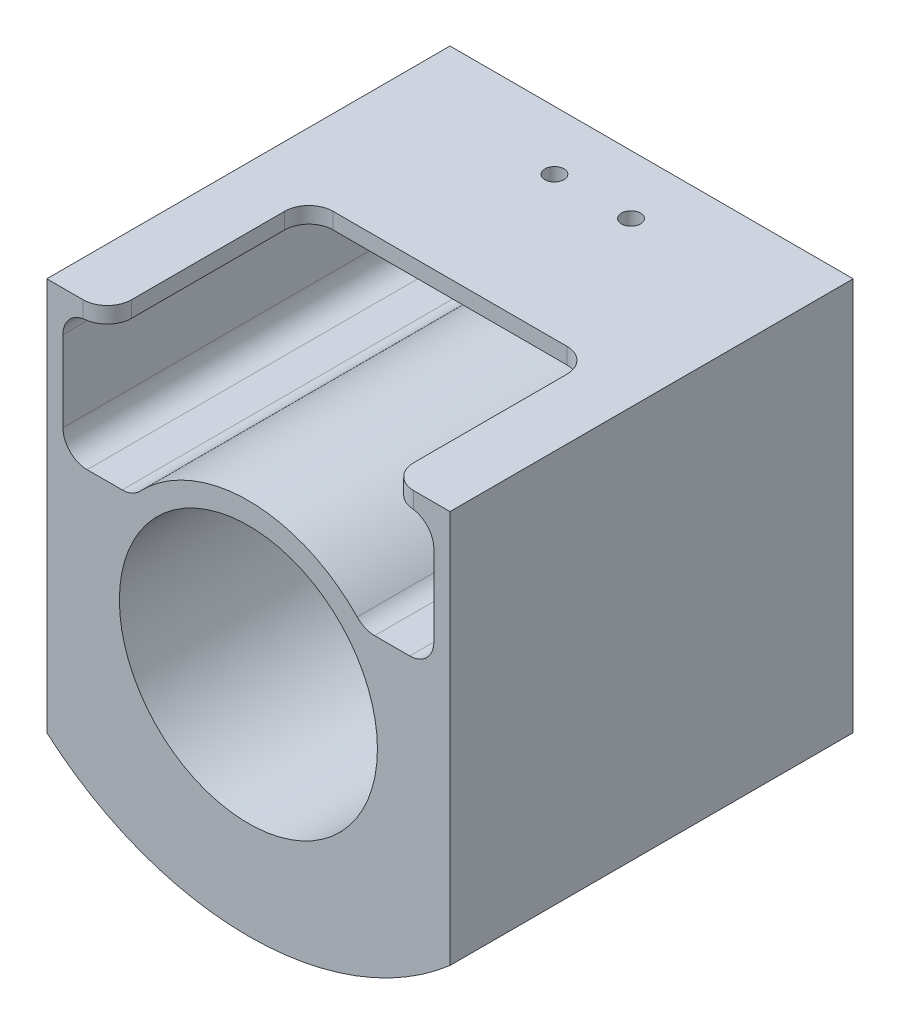
from build123d import *

# Parameters (mm, degrees)
BOSS_EXTRUDE2_DEPTH     = 50
CUT_EXTRUDE1_DEPTH      = 68.650646708
CUT_EXTRUDE1_DEPTH_BACK = 68.650646708
SKETCH2_R               = 16
CUT_EXTRUDE3_DEPTH      = 68.650646708
FILLET1_R               = 3
SKETCH5_W               = 35
SKETCH5_H               = 25
CUT_EXTRUDE4_DEPTH      = 10
FILLET2_R               = 3
SKETCH6_R               = 9.5
SKETCH6_R_2             = 1.25
BOSS_EXTRUDE3_DEPTH     = 5
CUT_EXTRUDE5_DEPTH      = 68.650646782
CUT_EXTRUDE5_DEPTH_BACK = 68.650646782
SKETCH7_R               = 2.5
CUT_EXTRUDE6_REACH      = 82.626
SKETCH8_R               = 1.175


with BuildPart() as part:
    # Sketch1 → Boss-Extrude2 (new body)
    with BuildSketch(Plane.XY):
        with BuildLine():
            Line((-25, 0), (-25, -28.750826075))
            ThreePointArc((-25, -28.750826075), (0, -38.1), (25, -28.750826075))
            Line((25, -28.750826075), (25, 0))
            Line((25, 0), (25, 20))
            Line((25, 20), (-25, 20))
            Line((-25, 20), (-25, 0))
        make_face()
    extrude(amount=BOSS_EXTRUDE2_DEPTH)

    # Sketch2 → Cut-Extrude1 (cut, two sides: drawn at the far end of the back side and taken through both)
    with BuildSketch(Plane.XY.offset(50).offset(-CUT_EXTRUDE1_DEPTH_BACK)):
        with Locations((0, -10)):
            Circle(SKETCH2_R)
    extrude(amount=CUT_EXTRUDE1_DEPTH + CUT_EXTRUDE1_DEPTH_BACK, mode=Mode.SUBTRACT)

    # Sketch4 → Cut-Extrude3 (cut, through all)
    with BuildSketch(Plane.XY.offset(50)):
        with BuildLine():
            Line((-23, 18), (23, 18))
            Line((23, 18), (23, 2))
            Line((23, 2), (14.317821063, 2))
            ThreePointArc((14.317821063, 2), (0, 8.681541692), (-14.317821063, 2))
            Line((-14.317821063, 2), (-23, 2))
            Line((-23, 2), (-23, 18))
        make_face()
    extrude(amount=-CUT_EXTRUDE3_DEPTH, mode=Mode.SUBTRACT)

    # Fillet1
    fillet1_edges = [part.edges().sort_by_distance(p)[0] for p in [
        (23, 18, 25),
        (23, 2, 25),
        (14.317821063, 2, 25),
        (-14.317821063, 2, 25),
        (-23, 2, 25),
        (-23, 18, 25),
    ]]
    fillet(fillet1_edges, radius=FILLET1_R)

    # Sketch5 → Cut-Extrude4 (cut)
    with BuildSketch(Plane(origin=(0, 20, 0), x_dir=(1, 0, 0), z_dir=(0, 1, 0))):
        with Locations((0, -37.5)):
            Rectangle(SKETCH5_W, SKETCH5_H)
    extrude(amount=-CUT_EXTRUDE4_DEPTH, mode=Mode.SUBTRACT)

    # Fillet2
    fillet2_edges = [part.edges().sort_by_distance(p)[0] for p in [
        (17.5, 19, 50),
        (17.5, 19, 25),
        (-17.5, 19, 25),
        (-17.5, 19, 50),
    ]]
    fillet(fillet2_edges, radius=FILLET2_R)

    # Sketch6 → Boss-Extrude3 (add)
    with BuildSketch(Plane.XY.offset(14)):
        with BuildLine():
            ThreePointArc((16, -10), (0, 6), (-16, -10))
            ThreePointArc((-16, -10), (0, -26), (16, -10))
        make_face()
        with Locations((0, -10)):
            Circle(SKETCH6_R, mode=Mode.SUBTRACT)
        with Locations((0, 3)):
            Circle(SKETCH6_R_2, mode=Mode.SUBTRACT)
        with Locations((13, -10)):
            Circle(SKETCH6_R_2, mode=Mode.SUBTRACT)
        with Locations((-13, -10)):
            Circle(SKETCH6_R_2, mode=Mode.SUBTRACT)
        with Locations((0, -23)):
            Circle(SKETCH6_R_2, mode=Mode.SUBTRACT)
    extrude(amount=-BOSS_EXTRUDE3_DEPTH)

    # Sketch7 → Cut-Extrude5 (cut, two sides: drawn at the far end of the back side and taken through both)
    with BuildSketch(Plane(origin=(0, 0, 0), x_dir=(0, 0, -1), z_dir=(1, 0, 0)).offset(-CUT_EXTRUDE5_DEPTH_BACK)):
        with Locations((-40, -32)):
            Circle(SKETCH7_R)
        with Locations((-10, -32)):
            Circle(SKETCH7_R)
    extrude(amount=CUT_EXTRUDE5_DEPTH + CUT_EXTRUDE5_DEPTH_BACK, mode=Mode.SUBTRACT)

    # Sketch8 → Cut-Extrude6 (cut, up to next)
    with BuildSketch(Plane(origin=(0, 20, 0), x_dir=(1, 0, 0), z_dir=(0, 1, 0)), mode=Mode.PRIVATE) as cut_extrude6_sk1:
        with Locations((-4.75, -7.3)):
            Circle(SKETCH8_R)
    cut_extrude6_tool1 = extrude(cut_extrude6_sk1.sketch, amount=-CUT_EXTRUDE6_REACH, mode=Mode.PRIVATE) & part.part
    # Sketch8 → Cut-Extrude6 (cut, up to next)
    with BuildSketch(Plane(origin=(0, 20, 0), x_dir=(1, 0, 0), z_dir=(0, 1, 0)), mode=Mode.PRIVATE) as cut_extrude6_sk2:
        with Locations((4.75, -7.3)):
            Circle(SKETCH8_R)
    cut_extrude6_tool2 = extrude(cut_extrude6_sk2.sketch, amount=-CUT_EXTRUDE6_REACH, mode=Mode.PRIVATE) & part.part
    add(cut_extrude6_tool1.solids().sort_by_distance((-4.75, 20, 7.3))[0], mode=Mode.SUBTRACT)
    add(cut_extrude6_tool2.solids().sort_by_distance((4.75, 20, 7.3))[0], mode=Mode.SUBTRACT)


solid = part.part
